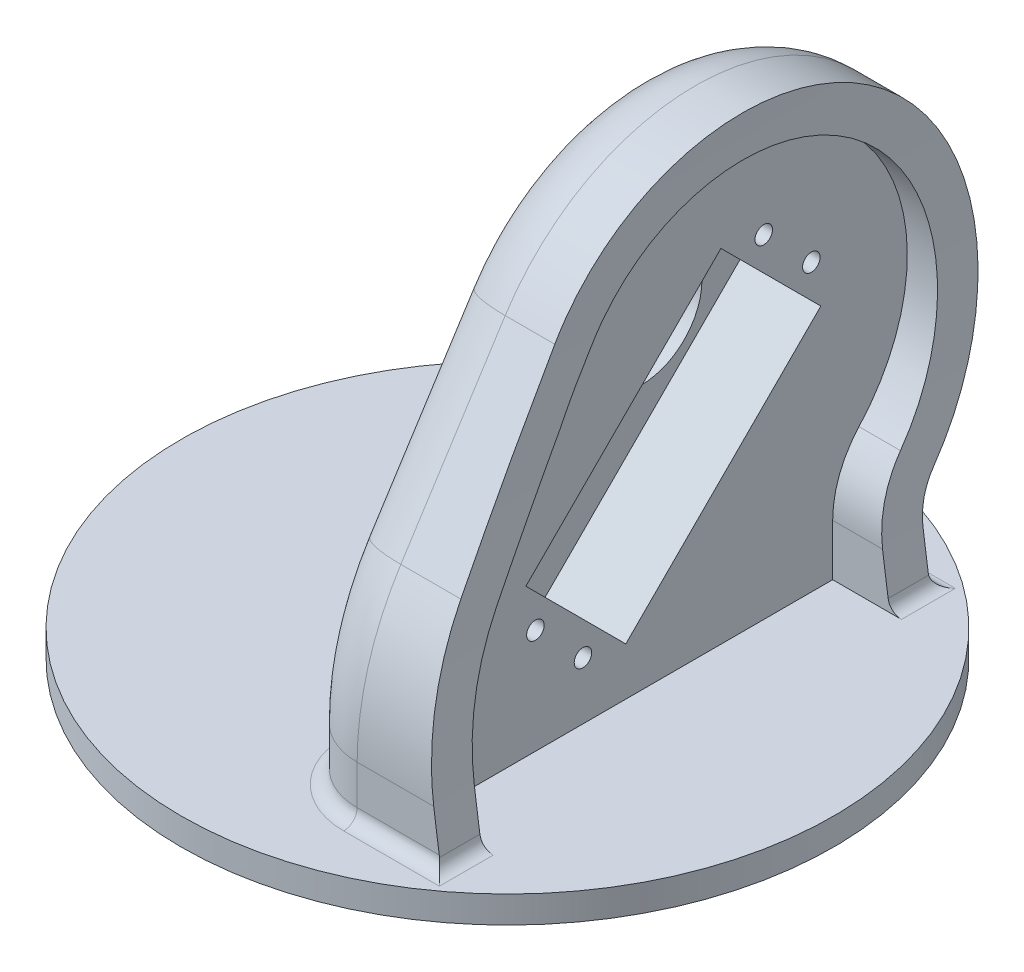
from build123d import *

# Parameters (mm, degrees)
SKETCH1_R                       = 48.5
SKETCH1_R_2                     = 1.5
BOSS_EXTRUDE1_DEPTH             = 4
SKETCH2_R                       = 3.75
CUT_EXTRUDE1_DEPTH              = 1.5
BOSS_EXTRUDE2_START             = 4
SKETCH3_R                       = 9
BOSS_EXTRUDE2_DEPTH             = 14
CUT_EXTRUDE3_START              = 6
SKETCH4_R                       = 1.3
CUT_EXTRUDE3_DEPTH              = 91.444646155
BOSS_EXTRUDE3_DEPTH             = 9
BOSS_EXTRUDE3_DIRECTION_2_REACH = 108.638
CUT_EXTRUDE4_DEPTH              = 101.75311462
CUT_EXTRUDE4_DEPTH_BACK         = 101.75311462
FILLET1_R                       = 10
FILLET2_R                       = 2


with BuildPart() as part:
    # Sketch1 → Boss-Extrude1 (new body)
    with BuildSketch(Plane(origin=(0, 0, 0), x_dir=(1, 0, 0), z_dir=(0, 1, 0))):
        with Locations(Location((0, 0, 0), (0, 0, 270))):
            Circle(SKETCH1_R)
        with Locations(Location((0, 7.25, 0), (0, 0, 270))):
            Circle(SKETCH1_R_2, mode=Mode.SUBTRACT)
        with Locations(Location((0, -7.25, 0), (0, 0, 270))):
            Circle(SKETCH1_R_2, mode=Mode.SUBTRACT)
    extrude(amount=BOSS_EXTRUDE1_DEPTH)

    # Sketch2 → Cut-Extrude1 (cut)
    with BuildSketch(Plane.XZ):
        with Locations(Location((0, 0, 0), (0, 0, 270))):
            Circle(SKETCH2_R)
    extrude(amount=-CUT_EXTRUDE1_DEPTH, mode=Mode.SUBTRACT)

    # Sketch3 → Boss-Extrude2 (add)
    with BuildSketch(Plane(origin=(0, 0, 0), x_dir=(0, 0, -1), z_dir=(1, 0, 0)).offset(BOSS_EXTRUDE2_START)):
        with BuildLine():
            Line((30.34, 4), (-30.34, 4))
            Line((-30.34, 4), (-30.34, 11.86))
            ThreePointArc((-30.34, 11.86), (-28.924736696, 21.745164753), (-24.792654999, 30.836113728))
            Line((-24.792654999, 30.836113728), (-9.278105641, 55.104149989))
            ThreePointArc((-9.278105641, 55.104149989), (30.651097233, 62.12443475), (34.252718415, 21.743078098))
            ThreePointArc((34.252718415, 21.743078098), (31.352340729, 17.057138369), (30.34, 11.64))
            Line((30.34, 11.64), (30.34, 4))
        make_face()
        with Locations((13.91, 40.28)):
            Circle(SKETCH3_R, mode=Mode.SUBTRACT)
    extrude(amount=BOSS_EXTRUDE2_DEPTH)

    # Sketch4 → Cut-Extrude3 (cut, through all)
    with BuildSketch(Plane(origin=(0, 0, 0), x_dir=(0, 0, -1), z_dir=(1, 0, 0)).offset(CUT_EXTRUDE3_START)):
        Polygon((-15.259242405, 25.959242405), (13.732135624, 54.950620434), (28.581378029, 40.101378029), (-0.41, 11.11), align=None)
        with Locations(Location((-13.845028843, 19.595281374, 0), (0, 0, 180))):
            Circle(SKETCH4_R)
        with Locations(Location((-6.773961031, 12.524213562, 0), (0, 0, 180))):
            Circle(SKETCH4_R)
        with Locations(Location((20.096096654, 53.536406871, 0), (0, 0, 180))):
            Circle(SKETCH4_R)
        with Locations(Location((27.167164466, 46.465339059, 0), (0, 0, 180))):
            Circle(SKETCH4_R)
    extrude(amount=CUT_EXTRUDE3_DEPTH, mode=Mode.SUBTRACT)

    # Sketch5 → Boss-Extrude3 (add)
    with BuildSketch(Plane(origin=(18, 0, 0), x_dir=(0, 0, -1), z_dir=(1, 0, 0))):
        with BuildLine():
            Line((30.34, 4), (36.34, 4))
            Line((36.34, 4), (36.34, 11.64))
            ThreePointArc((36.34, 11.64), (36.947404437, 14.890283021), (38.687631049, 17.701846859))
            ThreePointArc((38.687631049, 17.701846859), (34.300821036, 66.886736311), (-14.333340667, 58.335960445))
            Line((-14.333340667, 58.335960445), (-29.847890025, 34.067924184))
            ThreePointArc((-29.847890025, 34.067924184), (-34.683704058, 23.428701186), (-36.34, 11.86))
            Line((-36.34, 11.86), (-36.34, 4))
            Line((-36.34, 4), (-30.34, 4))
            Line((-30.34, 4), (-30.34, 11.86))
            ThreePointArc((-30.34, 11.86), (-28.924736696, 21.745164753), (-24.792654999, 30.836113728))
            Line((-24.792654999, 30.836113728), (-14.162524076, 47.463886585))
            ThreePointArc((-14.162524076, 47.463886585), (-11.806963139, 51.339412511), (-9.278105641, 55.104149989))
            ThreePointArc((-9.278105641, 55.104149989), (30.651097233, 62.12443475), (34.252718415, 21.743078098))
            ThreePointArc((34.252718415, 21.743078098), (31.352340729, 17.057138369), (30.34, 11.64))
            Line((30.34, 11.64), (30.34, 4))
        make_face()
    extrude(amount=BOSS_EXTRUDE3_DEPTH)

    # Boss-Extrude3 direction 2: up to this face of the body (flat: up to its plane)
    boss_extrude3_direction_2_end = Plane(part.part.faces().sort_by_distance((4, 32.000889593, -6.762869766))[0])
    # Sketch5 → Boss-Extrude3 direction 2 (add, up to the picked face)
    with BuildSketch(Plane(origin=(18, 0, 0), x_dir=(0, 0, -1), z_dir=(1, 0, 0)), mode=Mode.PRIVATE) as boss_extrude3_direction_2_sk1:
        with BuildLine():
            Line((30.34, 4), (36.34, 4))
            Line((36.34, 4), (36.34, 11.64))
            ThreePointArc((36.34, 11.64), (36.947404437, 14.890283021), (38.687631049, 17.701846859))
            ThreePointArc((38.687631049, 17.701846859), (34.300821036, 66.886736311), (-14.333340667, 58.335960445))
            Line((-14.333340667, 58.335960445), (-29.847890025, 34.067924184))
            ThreePointArc((-29.847890025, 34.067924184), (-34.683704058, 23.428701186), (-36.34, 11.86))
            Line((-36.34, 11.86), (-36.34, 4))
            Line((-36.34, 4), (-30.34, 4))
            Line((-30.34, 4), (-30.34, 11.86))
            ThreePointArc((-30.34, 11.86), (-28.924736696, 21.745164753), (-24.792654999, 30.836113728))
            Line((-24.792654999, 30.836113728), (-14.162524076, 47.463886585))
            ThreePointArc((-14.162524076, 47.463886585), (-11.806963139, 51.339412511), (-9.278105641, 55.104149989))
            ThreePointArc((-9.278105641, 55.104149989), (30.651097233, 62.12443475), (34.252718415, 21.743078098))
            ThreePointArc((34.252718415, 21.743078098), (31.352340729, 17.057138369), (30.34, 11.64))
            Line((30.34, 11.64), (30.34, 4))
        make_face()
    boss_extrude3_direction_2_tool1 = split(extrude(boss_extrude3_direction_2_sk1.sketch, amount=-BOSS_EXTRUDE3_DIRECTION_2_REACH, mode=Mode.PRIVATE), bisect_by=boss_extrude3_direction_2_end, keep=Keep.BOTH, mode=Mode.PRIVATE)
    add(boss_extrude3_direction_2_tool1.solids().sort_by(Axis((18, 7.82, -31.430412), (-1, 0, 0)))[0])

    # Sketch6 → Cut-Extrude4 (cut, two sides: drawn at the far end of the back side and taken through both)
    with BuildSketch(Plane.XY.offset(-CUT_EXTRUDE4_DEPTH_BACK)):
        with BuildLine():
            Line((27, 73.801694463), (21, 73.801694463))
            ThreePointArc((21, 73.801694463), (22.52665425, 38.804454133), (26.5, 4))
            Line((26.5, 4), (27, 4))
            Line((27, 4), (27, 73.801694463))
        make_face()
    extrude(amount=CUT_EXTRUDE4_DEPTH + CUT_EXTRUDE4_DEPTH_BACK, mode=Mode.SUBTRACT)

    # Fillet1
    # the kernel refuses this fillet: 10 mm, written as the material it takes off along each edge
    with BuildSketch(Plane(origin=(4, 11.86, 36.34), x_dir=(0, 0, -1), z_dir=(0, -1, 0))) as fillet1_piece_1:
        with BuildLine():
            CenterArc((FILLET1_R, FILLET1_R), FILLET1_R, 180, 90)
            Line((0, FILLET1_R), (0, 0))
            Line((0, 0), (FILLET1_R, 0))
        make_face()
    extrude(amount=7.86, mode=Mode.SUBTRACT)
    with BuildSketch(Plane(origin=(4, 11.86, -4.89), x_dir=(0, 0.5386350760234976, 0.8425391711233141), z_dir=(0, 0.8425391711233141, -0.5386350760234976))) as fillet1_piece_2:
        with BuildLine():
            CenterArc((41.23 - FILLET1_R, FILLET1_R), FILLET1_R, 270, 90)
            Line((41.23, FILLET1_R), (41.23, 0))
            Line((41.23, 0), (41.23 - FILLET1_R, 0))
        make_face()
    revolve(axis=Axis((4, 11.86, -4.89), (1, 0, 0)), revolution_arc=32.590770812, mode=Mode.SUBTRACT)
    with BuildSketch(Plane(origin=(4, 58.335960445, 14.333340667), x_dir=(0, -0.5386350760234987, -0.8425391711233132), z_dir=(0, -0.8425391711233133, 0.5386350760234988))) as fillet1_piece_3:
        with BuildLine():
            CenterArc((FILLET1_R, FILLET1_R), FILLET1_R, 180, 90)
            Line((0, FILLET1_R), (0, 0))
            Line((0, 0), (FILLET1_R, 0))
        make_face()
    extrude(amount=28.803451629, mode=Mode.SUBTRACT)
    with BuildSketch(Plane(origin=(4, 40.28, -13.91), x_dir=(0, -0.6735385398377844, -0.7391521056948869), z_dir=(0, -0.7391521056948869, 0.6735385398377844))) as fillet1_piece_4:
        with BuildLine():
            CenterArc((33.521694463 - FILLET1_R, FILLET1_R), FILLET1_R, 270, 90)
            Line((33.521694463, FILLET1_R), (33.521694463, 0))
            Line((33.521694463, 0), (33.521694463 - FILLET1_R, 0))
        make_face()
    revolve(axis=Axis((4, 40.28, -13.91), (1, 0, 0)), revolution_arc=189.749991197, mode=Mode.SUBTRACT)
    with BuildSketch(Plane(origin=(4, 4, -36.34), x_dir=(0, 0, 1), z_dir=(0, 1, 0))) as fillet1_piece_5:
        with BuildLine():
            CenterArc((FILLET1_R, FILLET1_R), FILLET1_R, 180, 90)
            Line((0, FILLET1_R), (0, 0))
            Line((0, 0), (FILLET1_R, 0))
        make_face()
    extrude(amount=7.64, mode=Mode.SUBTRACT)
    with BuildSketch(Plane(origin=(4, 11.64, -45.34), x_dir=(0, 0.6735385398377856, 0.7391521056948859), z_dir=(0, 0.7391521056948859, -0.6735385398377856))) as fillet1_piece_6:
        with BuildLine():
            CenterArc((9 + FILLET1_R, FILLET1_R), FILLET1_R, 180, 90)
            Line((9, FILLET1_R), (9, 0))
            Line((9, 0), (9 + FILLET1_R, 0))
        make_face()
    revolve(axis=Axis((4, 11.64, -45.34), (1, 0, 0)), revolution_arc=42.340762009, mode=Mode.SUBTRACT)

    # Fillet2
    fillet2_edges = [part.edges().sort_by_distance(p)[0] for p in [
        (20.25, 4, -36.34),
        (20.25, 4, 36.34),
        (6.928932188, 4, 33.411067812),
        (4, 4, 0),
        (6.928932188, 4, -33.411067812),
    ]]
    fillet(fillet2_edges, radius=FILLET2_R)
    fillet2_2_edges = [part.edges().sort_by_distance(p)[0] for p in [
        (26.5, 4, -33.34),
    ]]
    fillet(fillet2_2_edges, radius=FILLET2_R)
    fillet2_3_edges = [part.edges().sort_by_distance(p)[0] for p in [
        (26.5, 4, 33.34),
    ]]
    fillet(fillet2_3_edges, radius=FILLET2_R)


solid = part.part
